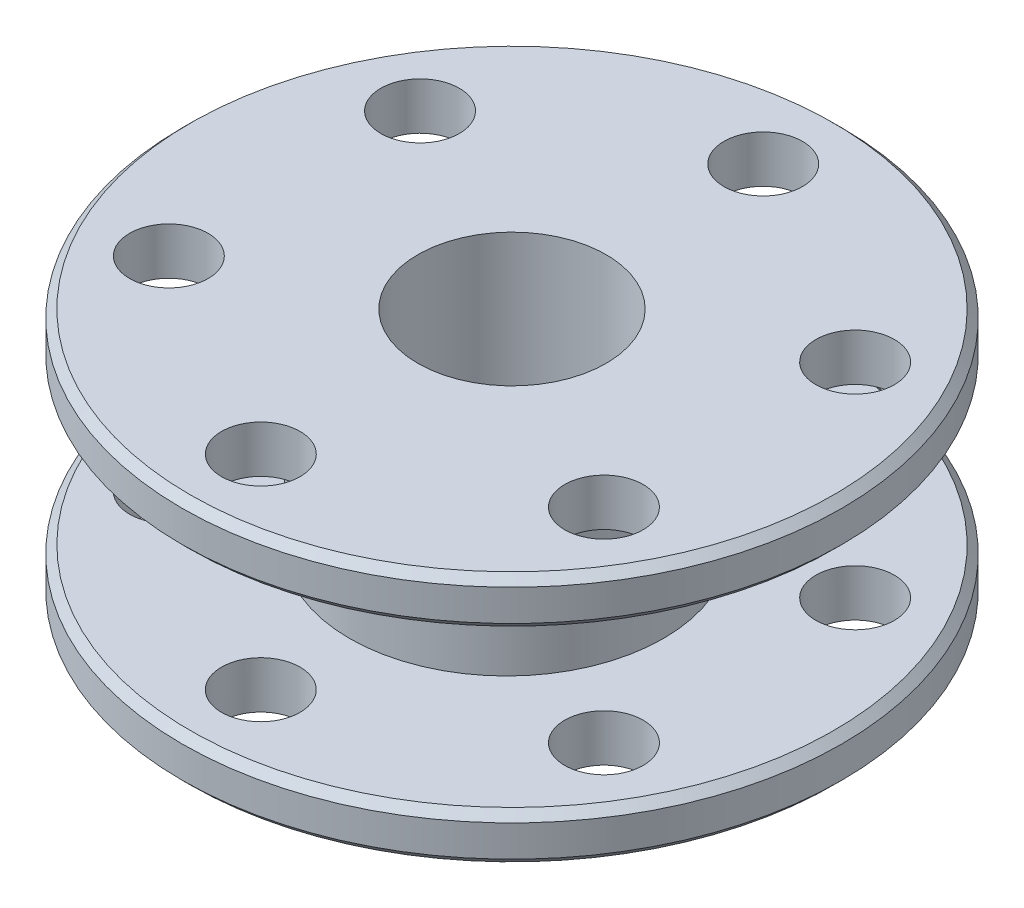
from build123d import *

# Parameters (mm, degrees)
SKETCH1_R           = 21
SKETCH1_R_2         = 6
SKETCH1_R_3         = 2.5
BOSS_EXTRUDE1_DEPTH = 16
SKETCH2_W           = 18.103008707
SKETCH2_H           = 10
CHAMFER1_SIZE       = 0.5


with BuildPart() as part:
    # Sketch1 → Boss-Extrude1 (new body)
    with BuildSketch(Plane(origin=(0, 0, 0), x_dir=(1, 0, 0), z_dir=(0, 1, 0))):
        Circle(SKETCH1_R)
        Circle(SKETCH1_R_2, mode=Mode.SUBTRACT)
        with Locations((0, 16)):
            Circle(SKETCH1_R_3, mode=Mode.SUBTRACT)
        with Locations((13.856406461, 8)):
            Circle(SKETCH1_R_3, mode=Mode.SUBTRACT)
        with Locations((13.856406461, -8)):
            Circle(SKETCH1_R_3, mode=Mode.SUBTRACT)
        with Locations((0, -16)):
            Circle(SKETCH1_R_3, mode=Mode.SUBTRACT)
        with Locations((-13.856406461, -8)):
            Circle(SKETCH1_R_3, mode=Mode.SUBTRACT)
        with Locations((-13.856406461, 8)):
            Circle(SKETCH1_R_3, mode=Mode.SUBTRACT)
    extrude(amount=BOSS_EXTRUDE1_DEPTH)

    # Sketch2 → Cut-Revolve1 (revolve, cut)
    with BuildSketch(Plane(origin=(0, 0, 0), x_dir=(0, 0, -1), z_dir=(1, 0, 0))):
        with Locations((18.702543153, 8)):
            Rectangle(SKETCH2_W, SKETCH2_H)
    revolve(axis=Axis((0, 0, 0.348961201), (0, 1, 0)), mode=Mode.SUBTRACT)

    # Chamfer1
    chamfer1_edges = [part.edges().sort_by_distance(p)[0] for p in [
        (-21, 0, 0),
        (-21, 3, 0),
        (-21, 16, 0),
        (-21, 13, 0),
    ]]
    chamfer(chamfer1_edges, length=CHAMFER1_SIZE)


solid = part.part
